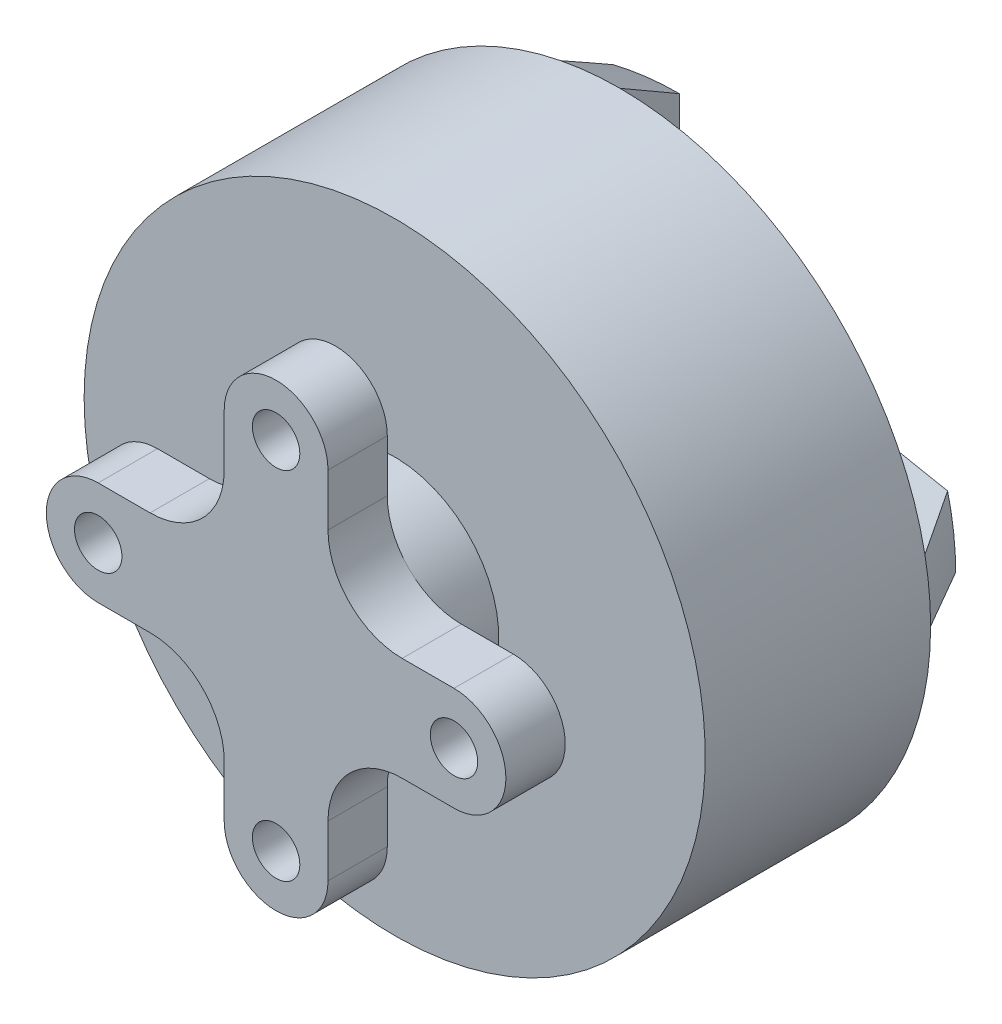
from build123d import *
from OCP.BRepFilletAPI import BRepFilletAPI_MakeChamfer
from build123d.topology import SkipClean

# Parameters (mm, degrees)
SKETCH1_R                      = 0.8
BOSS_EXTRUDE1_DEPTH            = 2
FILLET2_R                      = 2.5
SKETCH2_R                      = 3.51040764
BOSS_EXTRUDE2_DEPTH            = 2
BOSS_EXTRUDE3_START            = -2
SKETCH3_R                      = 10.475
BOSS_EXTRUDE3_DEPTH            = 7.6
SKETCH4_R                      = 8.475
CUT_EXTRUDE1_DEPTH             = 2
SKETCH5_R                      = 0.75
BOSS_EXTRUDE4_DEPTH            = 2
CHAMFER1_SIZE2                 = 1.154700538
CHAMFER1_SIZE                  = 2
CIRPATTERN2_COUNT              = 4
CHAMFER1_OF_CIRPATTERN2_SIZE   = 2
CHAMFER1_OF_CIRPATTERN2_SIZE_2 = 1.154700538
SKETCH6_R                      = 0.73
BOSS_EXTRUDE5_DEPTH            = 3.5


with BuildPart() as part:
    # Sketch1 → Boss-Extrude1 (new body)
    with BuildSketch(Plane(origin=(0, 0, 0), x_dir=(0, 1, 0), z_dir=(0, 0, 1))):
        with BuildLine():
            Line((-1.75, 1.75), (-1.75, 6))
            ThreePointArc((-1.75, 6), (0, 7.75), (1.75, 6))
            Line((1.75, 6), (1.75, 1.75))
            Line((1.75, 1.75), (6, 1.75))
            ThreePointArc((6, 1.75), (7.75, 0), (6, -1.75))
            Line((6, -1.75), (1.75, -1.75))
            Line((1.75, -1.75), (1.75, -6))
            ThreePointArc((1.75, -6), (0, -7.75), (-1.75, -6))
            Line((-1.75, -6), (-1.75, -1.75))
            Line((-1.75, -1.75), (-6, -1.75))
            ThreePointArc((-6, -1.75), (-7.75, 0), (-6, 1.75))
            Line((-6, 1.75), (-1.75, 1.75))
        make_face()
        with Locations(Location((0, 6, 0), (0, 0, 270))):
            Circle(SKETCH1_R, mode=Mode.SUBTRACT)
        with Locations(Location((6, 0, 0), (0, 0, 270))):
            Circle(SKETCH1_R, mode=Mode.SUBTRACT)
        with Locations(Location((0, -6, 0), (0, 0, 270))):
            Circle(SKETCH1_R, mode=Mode.SUBTRACT)
        with Locations(Location((-6, 0, 0), (0, 0, 270))):
            Circle(SKETCH1_R, mode=Mode.SUBTRACT)
    extrude(amount=BOSS_EXTRUDE1_DEPTH)

    # Fillet2
    fillet2_edges = [part.edges().sort_by_distance(p)[0] for p in [
        (1.75, 1.75, 1),
        (1.75, -1.75, 1),
        (-1.75, -1.75, 1),
        (-1.75, 1.75, 1),
    ]]
    fillet(fillet2_edges, radius=FILLET2_R)

    # Sketch2 → Boss-Extrude2 (add)
    with BuildSketch(Plane(origin=(0, 0, 0), x_dir=(1, 0, 0), z_dir=(0, 0, -1))):
        with Locations(Location((0, 0, 0), (0, 0, 45))):
            Circle(SKETCH2_R)
    extrude(amount=BOSS_EXTRUDE2_DEPTH)

    # Sketch3 → Boss-Extrude3 (add)
    with BuildSketch(Plane(origin=(0, 0, 0), x_dir=(0, 1, 0), z_dir=(0, 0, 1)).offset(BOSS_EXTRUDE3_START)):
        with Locations(Location((0, 0, 0), (0, 0, 270))):
            Circle(SKETCH3_R)
    extrude(amount=-BOSS_EXTRUDE3_DEPTH)

    # Sketch4 → Cut-Extrude1 (cut)
    with BuildSketch(Plane(origin=(0, 0, -9.6), x_dir=(1, 0, 0), z_dir=(0, 0, -1))):
        with Locations(Location((0, 0, 0), (0, 0, 180))):
            Circle(SKETCH4_R)
    extrude(amount=-CUT_EXTRUDE1_DEPTH, mode=Mode.SUBTRACT)

    # Sketch5 → Boss-Extrude4 (add)
    with BuildSketch(Plane(origin=(0, 0, -9.6), x_dir=(1, 0, 0), z_dir=(0, 0, -1))):
        with BuildLine():
            Line((0, 0), (-4, 0))
            Line((-4, 0), (-2, -10.282296679))
            ThreePointArc((-2, -10.282296679), (-1.004631098, -10.426712874), (0, -10.475))
            Line((0, -10.475), (0, 0))
        make_face()
        with Locations(Location((-1.7, -1.7, 0), (0, 0, 180))):
            Circle(SKETCH5_R, mode=Mode.SUBTRACT)
    boss_extrude4 = extrude(amount=BOSS_EXTRUDE4_DEPTH)

    # Chamfer1
    chamfer1_edges = [part.edges().sort_by_distance(p)[0] for p in [
        (-1.004631098, 10.426712874, -11.6),
    ]]
    chamfer1_side = [part.faces().sort_by_distance(p)[0] for p in [
        (-1.004631098, 10.426712874, -11.576905989),
    ]]
    chamfer(chamfer1_edges, length=CHAMFER1_SIZE - 0.0001, length2=CHAMFER1_SIZE2 - 0.0001, reference=chamfer1_side[0])  # a hair under: the kernel refuses the full size

    # CirPattern2: Boss-Extrude4 ×4 about axis
    with SkipClean():  # the faces are left unmerged after this step: merging them gives an invalid solid
        cirpattern2_axis = Axis((0, 0, 0), (0, 0, 1))
        for i in range(1, CIRPATTERN2_COUNT):
            add(boss_extrude4.rotate(cirpattern2_axis, i * 360 / CIRPATTERN2_COUNT))

    # Chamfer1 of CirPattern2
    chamfer1_of_cirpattern2_edges_1 = [part.edges().sort_by_distance(p)[0] for p in [
        (-10.426712874, -1.004631098, -11.6),
    ]]
    chamfer1_of_cirpattern2_side_1 = [part.faces().sort_by_distance(p)[0] for p in [
        (-10.426712874, -1.004631098, -11.576905989),
    ]]
    chamfer1_of_cirpattern2_edges_2 = [part.edges().sort_by_distance(p)[0] for p in [
        (1.004631098, -10.426712874, -11.6),
    ]]
    chamfer1_of_cirpattern2_side_2 = [part.faces().sort_by_distance(p)[0] for p in [
        (1.004631098, -10.426712874, -11.576905989),
    ]]
    chamfer1_of_cirpattern2_edges_3 = [part.edges().sort_by_distance(p)[0] for p in [
        (10.426712874, 1.004631098, -11.6),
    ]]
    chamfer1_of_cirpattern2_side_3 = [part.faces().sort_by_distance(p)[0] for p in [
        (10.426712874, 1.004631098, -11.576905989),
    ]]
    chamfer1_of_cirpattern2 = BRepFilletAPI_MakeChamfer(part.part.solid().wrapped)
    for e in chamfer1_of_cirpattern2_edges_1:
        chamfer1_of_cirpattern2.Add(CHAMFER1_OF_CIRPATTERN2_SIZE - 0.0001, CHAMFER1_OF_CIRPATTERN2_SIZE_2 - 0.0001, e.wrapped, chamfer1_of_cirpattern2_side_1[0].wrapped)
    for e in chamfer1_of_cirpattern2_edges_2:
        chamfer1_of_cirpattern2.Add(CHAMFER1_OF_CIRPATTERN2_SIZE - 0.0001, CHAMFER1_OF_CIRPATTERN2_SIZE_2 - 0.0001, e.wrapped, chamfer1_of_cirpattern2_side_2[0].wrapped)
    for e in chamfer1_of_cirpattern2_edges_3:
        chamfer1_of_cirpattern2.Add(CHAMFER1_OF_CIRPATTERN2_SIZE - 0.0001, CHAMFER1_OF_CIRPATTERN2_SIZE_2 - 0.0001, e.wrapped, chamfer1_of_cirpattern2_side_3[0].wrapped)
    add(Compound.cast(chamfer1_of_cirpattern2.Shape()), mode=Mode.REPLACE)  # a hair under: the kernel refuses the full size

    # Sketch6 → Boss-Extrude5 (add)
    with BuildSketch(Plane(origin=(0, 0, -11.6), x_dir=(1, 0, 0), z_dir=(0, 0, -1))):
        with Locations(Location((0, 0, 0), (0, 0, 180))):
            Circle(SKETCH6_R)
    extrude(amount=BOSS_EXTRUDE5_DEPTH)


solid = part.part
